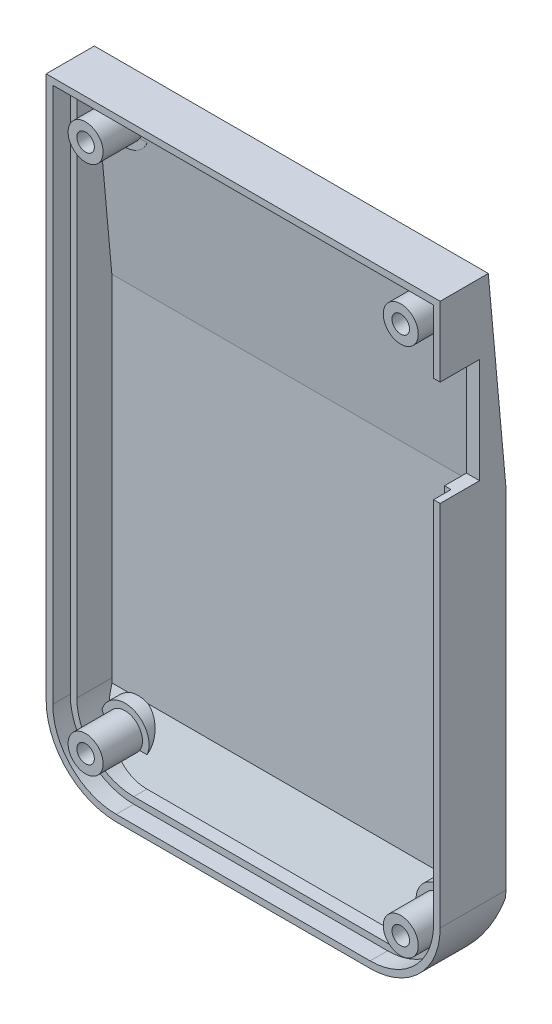
from build123d import *

# Parameters (mm, degrees)
EXTRUDE_1_DEPTH     = 7.5
CUT_EXTRUDE_1_DEPTH = 84.553874835
SHELL_1_T           = -1.5
CUT_EXTRUDE_START   = -2
CUT_EXTRUDE_2_DEPTH = 2
SKETCH_4_R          = 2.75
EXTRUDE_2_DEPTH     = 1.5
SKETCH_5_R          = 2
EXTRUDE_3_DEPTH     = 4.5
SKETCH_6_R          = 1.75
CUT_EXTRUDE_3_DEPTH = 2
SKETCH_9_R          = 1
CUT_EXTRUDE_4_DEPTH = 84.553874835
SKETCH_12_W         = 1.5
SKETCH_12_H         = 12
CUT_EXTRUDE_6_DEPTH = 4.5
CUT_EXTRUDE_7_DEPTH = 84.553874835
SKETCH_13_W         = 30
SKETCH_13_H         = 25
CUT_EXTRUDE_8_DEPTH = 0.5


with BuildPart() as part:
    # 草图1 → 凸台-拉伸1 (new body)
    with BuildSketch(Plane.XY):
        with BuildLine():
            Line((-45, 70), (0, 70))
            Line((0, 70), (0, 8))
            ThreePointArc((0, 8), (-2.343145751, 2.343145751), (-8, 0))
            Line((-8, 0), (-37, 0))
            ThreePointArc((-37, 0), (-42.656854249, 2.343145751), (-45, 8))
            Line((-45, 8), (-45, 70))
        make_face()
    extrude(amount=EXTRUDE_1_DEPTH)

    # 草图2 → 切除-拉伸1 (cut, through all)
    with BuildSketch(Plane(origin=(0, 0, 0), x_dir=(0, 0, -1), z_dir=(1, 0, 0))):
        Polygon((0, 0), (0, 7.2), (-3, 0), align=None)
        Polygon((0, 70), (-2, 70), (0, 48), align=None)
    extrude(amount=-CUT_EXTRUDE_1_DEPTH, mode=Mode.SUBTRACT)

    # 抽壳1
    shell_1_openings = [part.faces().sort_by_distance(p)[0] for p in [
        (-22.5, 35.292176643, 7.5),
    ]]
    offset(amount=SHELL_1_T, openings=shell_1_openings, kind=Kind.INTERSECTION)

    # 草图3 → 切除-拉伸2 (cut)
    with BuildSketch(Plane.XY.offset(7.5).offset(CUT_EXTRUDE_START)):
        with BuildLine():
            Line((-44.25, 69.25), (-0.75, 69.25))
            Line((-0.75, 69.25), (-0.75, 8))
            ThreePointArc((-0.75, 8), (-2.873475836, 2.873475836), (-8, 0.75))
            Line((-8, 0.75), (-37, 0.75))
            ThreePointArc((-37, 0.75), (-42.126524164, 2.873475836), (-44.25, 8))
            Line((-44.25, 8), (-44.25, 69.25))
        make_face()
        with BuildLine():
            Line((-43.5, 68.5), (-1.5, 68.5))
            Line((-1.5, 68.5), (-1.5, 8))
            ThreePointArc((-1.5, 8), (-3.403805922, 3.403805922), (-8, 1.5))
            Line((-8, 1.5), (-37, 1.5))
            ThreePointArc((-37, 1.5), (-41.596194078, 3.403805922), (-43.5, 8))
            Line((-43.5, 8), (-43.5, 68.5))
        make_face(mode=Mode.SUBTRACT)
    extrude(amount=CUT_EXTRUDE_2_DEPTH, mode=Mode.SUBTRACT)

    # 草图4 → 凸台-拉伸2 (add)
    with BuildSketch(Plane.XY.offset(1.5)):
        with Locations((-40.5, 65.5)):
            Circle(SKETCH_4_R)
        with Locations((-40.5, 5)):
            Circle(SKETCH_4_R)
        with Locations((-4.5, 5)):
            Circle(SKETCH_4_R)
        with Locations((-4.5, 65.5)):
            Circle(SKETCH_4_R)
    extrude(amount=EXTRUDE_2_DEPTH)

    # 草图5 → 凸台-拉伸3 (add)
    with BuildSketch(Plane.XY.offset(3)):
        with Locations((-40.5, 65.5)):
            Circle(SKETCH_5_R)
        with Locations((-4.5, 65.5)):
            Circle(SKETCH_5_R)
        with Locations((-40.5, 5)):
            Circle(SKETCH_5_R)
        with Locations((-4.5, 5)):
            Circle(SKETCH_5_R)
    extrude(amount=EXTRUDE_3_DEPTH)

    # 草图6 → 切除-拉伸3 (cut)
    with BuildSketch(Plane(origin=(0, 0, 0), x_dir=(-1, 0, 0), z_dir=(0, 0, -1))):
        with Locations((4.5, 65.5)):
            Circle(SKETCH_6_R)
        with Locations((40.5, 65.5)):
            Circle(SKETCH_6_R)
        with Locations((40.5, 5)):
            Circle(SKETCH_6_R)
        with Locations((4.5, 5)):
            Circle(SKETCH_6_R)
    extrude(amount=-CUT_EXTRUDE_3_DEPTH, mode=Mode.SUBTRACT)

    # 草图9 → 切除-拉伸4 (cut, through all)
    with BuildSketch(Plane.XY):
        with Locations((-40.5, 65.5)):
            Circle(SKETCH_9_R)
        with Locations((-4.5, 65.5)):
            Circle(SKETCH_9_R)
        with Locations((-4.5, 5)):
            Circle(SKETCH_9_R)
        with Locations((-40.5, 5)):
            Circle(SKETCH_9_R)
    extrude(amount=CUT_EXTRUDE_4_DEPTH, mode=Mode.SUBTRACT)

    # 草图12 → 切除-拉伸6 (cut)
    with BuildSketch(Plane.XY.offset(7.5)):
        with Locations((-0.75, 56)):
            Rectangle(SKETCH_12_W, SKETCH_12_H)
    extrude(amount=-CUT_EXTRUDE_6_DEPTH, mode=Mode.SUBTRACT)

    # 草图2<3> → 切除-拉伸7 (cut, through all)
    with BuildSketch(Plane(origin=(0, 0, 0), x_dir=(0, 0, -1), z_dir=(1, 0, 0))):
        Polygon((0, 0), (0, 7.2), (-3, 0), align=None)
        Polygon((0, 70), (-2, 70), (0, 48), align=None)
    extrude(amount=-CUT_EXTRUDE_7_DEPTH, mode=Mode.SUBTRACT)

    # 草图13 → 切除-拉伸8 (cut)
    with BuildSketch(Plane(origin=(0, 0, 0), x_dir=(-1, 0, 0), z_dir=(0, 0, -1))):
        with Locations((22.5, 30.5)):
            Rectangle(SKETCH_13_W, SKETCH_13_H)
    extrude(amount=-CUT_EXTRUDE_8_DEPTH, mode=Mode.SUBTRACT)


solid = part.part
